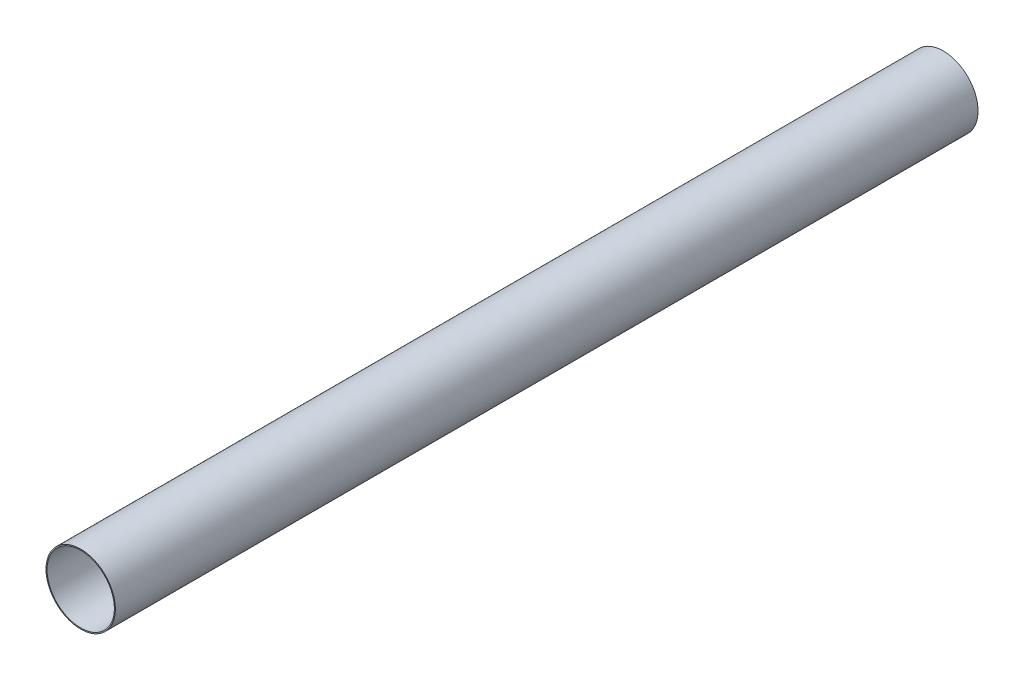
from build123d import *

# Parameters (mm, degrees)
SKETCH1_R           = 51.054
SKETCH1_R_2         = 49.53
BOSS_EXTRUDE1_DEPTH = 1270


with BuildPart() as part:
    # Sketch1 → Boss-Extrude1 (new body)
    with BuildSketch(Plane.XY):
        Circle(SKETCH1_R)
        Circle(SKETCH1_R_2, mode=Mode.SUBTRACT)
    extrude(amount=BOSS_EXTRUDE1_DEPTH)


solid = part.part
